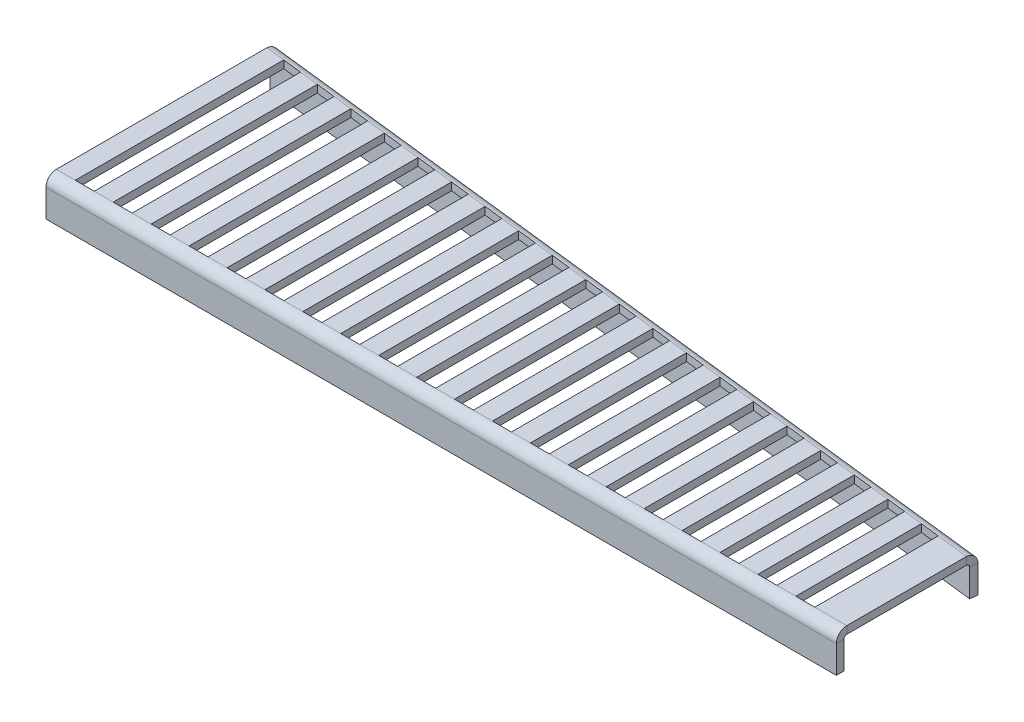
from build123d import *

# Parameters (mm, degrees)
BASE_FLANGE1_DEPTH = 2
EDGE_FLANGE1_DEPTH = 209.802637019
EDGE_FLANGE2_DEPTH = 208.43
CUT_EXTRUDE1_DEPTH = 10
CUT_EXTRUDE2_DEPTH = 10
CUT_EXTRUDE3_DEPTH = 10
CUT_EXTRUDE4_DEPTH = 10


# Sheet-metal steps are written as plain solids
with BuildPart() as part:
    # Sketch1 → Base-Flange1 (new body)
    with BuildSketch(Plane(origin=(0, 0, 0), x_dir=(1, 0, 0), z_dir=(0, 1, 0))):
        Polygon((0, 0), (208.43, 0), (208.43, 31.04), (0, 55), align=None)
    extrude(amount=-BASE_FLANGE1_DEPTH)

    # Edge-Flange1 section (across the edge) → Edge-Flange1 (add)
    with BuildSketch(Plane(origin=(0.084121612, -2, -55.731780783), x_dir=(-0.1142025683779395, -3.4914813388431334e-15, 0.9934574844329687), z_dir=(0.9934574844329687, 0, 0.1142025683779395))):
        with BuildLine():
            Line((-2, 0.7366), (-2, 8))
            Line((-2, 8), (0, 8))
            Line((0, 8), (0, 0.7366))
            ThreePointArc((0, 0.7366), (0.215745145, 0.215745145), (0.7366, 0))
            Line((0.7366, 0), (0.7366, -2))
            ThreePointArc((0.7366, -2), (-1.198468417, -1.198468417), (-2, 0.7366))
        make_face()
    extrude(amount=EDGE_FLANGE1_DEPTH)

    # Edge-Flange2 section (across the edge) → Edge-Flange2 (add)
    with BuildSketch(Plane(origin=(208.43, -2, 1.2766), x_dir=(0, 0, -1), z_dir=(-1, 0, 0))):
        with BuildLine():
            Line((-2, 0.7366), (-2, 8))
            Line((-2, 8), (0, 8))
            Line((0, 8), (0, 0.7366))
            ThreePointArc((0, 0.7366), (0.215745145, 0.215745145), (0.7366, 0))
            Line((0.7366, 0), (1.2766, 0))
            Line((1.2766, 0), (1.2766, -2))
            Line((1.2766, -2), (0.7366, -2))
            ThreePointArc((0.7366, -2), (-1.198468417, -1.198468417), (-2, 0.7366))
        make_face()
    extrude(amount=EDGE_FLANGE2_DEPTH)

    # Sketch12 → Cut-Extrude1 (cut)
    with BuildSketch(Plane(origin=(0, 0, 0), x_dir=(1, 0, 0), z_dir=(0, 1, 0))):
        Polygon((5, 54.425226695), (5, -0.54), (10, -0.54), (10, 53.85045339), align=None)
    extrude(amount=-CUT_EXTRUDE1_DEPTH, mode=Mode.SUBTRACT)

    # Sketch13 → Cut-Extrude2 (cut)
    with BuildSketch(Plane(origin=(0, 0, 0), x_dir=(1, 0, 0), z_dir=(0, 1, 0))):
        Polygon((15, 53.275680084), (15, -0.54), (20, -0.54), (20, 52.700906779), align=None)
        Polygon((25, 52.126133474), (25, -0.54), (30, -0.54), (30, 51.551360169), align=None)
        Polygon((35, 50.976586864), (35, -0.54), (40, -0.54), (40, 50.401813559), align=None)
        Polygon((45, 49.827040253), (45, -0.54), (50, -0.54), (50, 49.252266948), align=None)
    extrude(amount=-CUT_EXTRUDE2_DEPTH, mode=Mode.SUBTRACT)

    # Sketch14 → Cut-Extrude3 (cut)
    with BuildSketch(Plane(origin=(0, 0, 0), x_dir=(1, 0, 0), z_dir=(0, 1, 0))):
        Polygon((55, 48.677493643), (55, -0.54), (60, -0.54), (60, 48.102720338), align=None)
        Polygon((65, 47.527947033), (65, -0.54), (70, -0.54), (70, 46.953173727), align=None)
        Polygon((75, 46.378400422), (75, -0.54), (80, -0.54), (80, 45.803627117), align=None)
        Polygon((85, 45.228853812), (85, -0.54), (90, -0.54), (90, 44.654080507), align=None)
        Polygon((95, 44.079307201), (95, -0.54), (100, -0.54), (100, 43.504533896), align=None)
        Polygon((105, 42.929760591), (105, -0.54), (110, -0.54), (110, 42.354987286), align=None)
        Polygon((115, 41.780213981), (115, -0.54), (120, -0.54), (120, 41.205440676), align=None)
    extrude(amount=-CUT_EXTRUDE3_DEPTH, mode=Mode.SUBTRACT)

    # Sketch15 → Cut-Extrude4 (cut)
    with BuildSketch(Plane(origin=(0, 0, 0), x_dir=(1, 0, 0), z_dir=(0, 1, 0))):
        Polygon((125, 40.63066737), (125, -0.54), (130, -0.54), (130, 40.055894065), align=None)
        Polygon((135, 39.48112076), (135, -0.54), (140, -0.54), (140, 38.906347455), align=None)
        Polygon((145, 38.33157415), (145, -0.54), (150, -0.54), (150, 37.756800844), align=None)
        Polygon((155, 37.182027539), (155, -0.54), (160, -0.54), (160, 36.607254234), align=None)
        Polygon((165, 36.032480929), (165, -0.54), (170, -0.54), (170, 35.457707624), align=None)
        Polygon((175, 34.882934318), (175, -0.54), (180, -0.54), (180, 34.308161013), align=None)
        Polygon((185, 33.733387708), (185, -0.54), (190, -0.54), (190, 33.158614403), align=None)
        Polygon((195, 32.583841098), (195, -0.54), (200, -0.54), (200, 32.009067793), align=None)
    extrude(amount=-CUT_EXTRUDE4_DEPTH, mode=Mode.SUBTRACT)


solid = part.part
